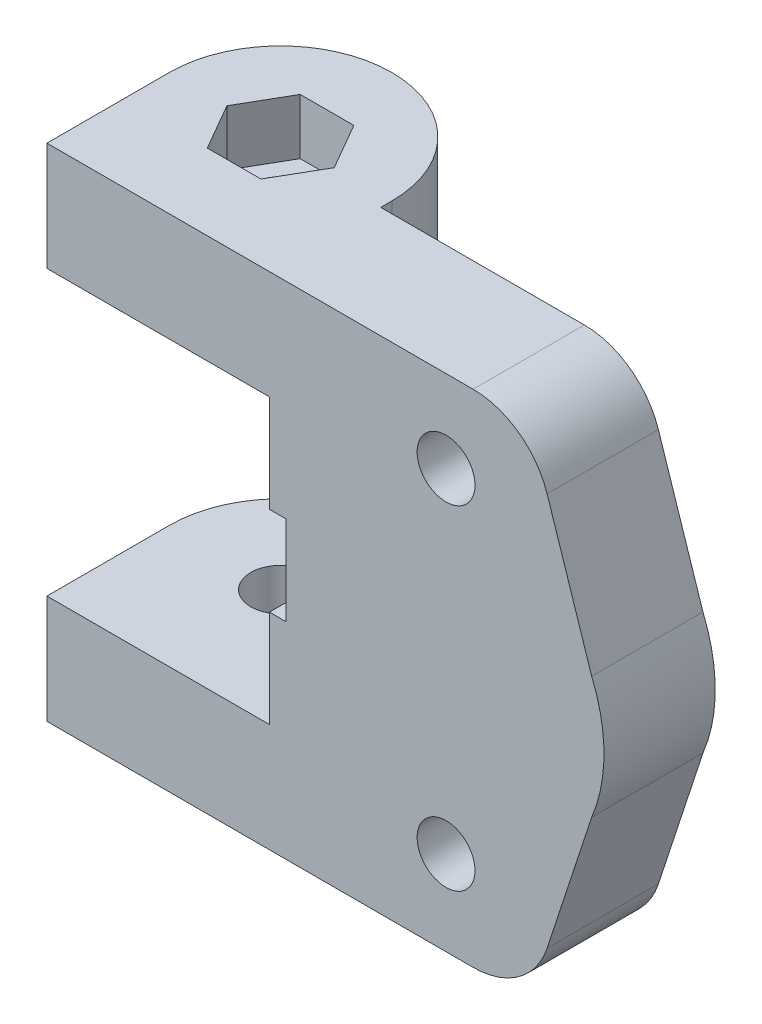
from build123d import *

# Parameters (mm, degrees)
SKETCH1_R           = 9.5
BOSS_EXTRUDE1_DEPTH = 10
BOSS_EXTRUDE4_START = -9.75
BOSS_EXTRUDE4_DEPTH = 9.75
BOSS_EXTRUDE5_DEPTH = 9.75
SKETCH19_R          = 2.675
CUT_EXTRUDE1_DEPTH  = 54.237071403
CUT_EXTRUDE2_DEPTH  = 1
SKETCH21_R          = 9.541498329
BOSS_EXTRUDE6_DEPTH = 8
SKETCH22_W          = 10.184582577
SKETCH22_H          = 8
CUT_EXTRUDE3_DEPTH  = 1
SKETCH24_R          = 2.6
BOSS_EXTRUDE8_DEPTH = 1
SKETCH25_R          = 2.6
BOSS_EXTRUDE9_DEPTH = 5
SKETCH26_R          = 4.5
CUT_EXTRUDE4_DEPTH  = 5
CUT_EXTRUDE5_DEPTH  = 5
FILLET1_R           = 3
FILLET2_R           = 10


with BuildPart() as part:
    # Sketch1 → Boss-Extrude1 (new body)
    with BuildSketch(Plane.XY):
        with BuildLine():
            Line((-23.433441641, -14.957015859), (-23.433441641, -24.707015859))
            Line((-23.433441641, -24.707015859), (14.870192677, -24.707015859))
            ThreePointArc((14.870192677, -24.707015859), (18.975681404, -23.376668609), (21.520677092, -19.891290805))
            Line((21.520677092, -19.891290805), (25.525569024, -7.69755511))
            ThreePointArc((25.525569024, -7.69755511), (26.630542081, -2.207015859), (25.525569024, 3.283523393))
            Line((25.525569024, 3.283523393), (21.520677092, 15.477259087))
            ThreePointArc((21.520677092, 15.477259087), (18.975681404, 18.962636892), (14.870192677, 20.292984141))
            Line((14.870192677, 20.292984141), (-23.433441641, 20.292984141))
            Line((-23.433441641, 20.292984141), (-23.433441641, 10.542984141))
            Line((-23.433441641, 10.542984141), (-3.433441641, 10.542984141))
            Line((-3.433441641, 10.542984141), (-3.433441641, 1.794523598))
            Line((-3.433441641, 1.794523598), (-1.933441641, 1.794523598))
            Line((-1.933441641, 1.794523598), (-1.933441641, -6.205476402))
            Line((-1.933441641, -6.205476402), (-3.433441641, -6.205476402))
            Line((-3.433441641, -6.205476402), (-3.433441641, -14.957015859))
            Line((-3.433441641, -14.957015859), (-23.433441641, -14.957015859))
        make_face()
        with Locations((12.436989349, -2.207015859)):
            Circle(SKETCH1_R, mode=Mode.SUBTRACT)
        Polygon((10.026551975, -12.925000001), (14.847426723, -12.925000001), (17.257864097, -17.100000001), (14.847426723, -21.275000001), (10.026551975, -21.275000001), (7.616114601, -17.100000001), align=None, mode=Mode.SUBTRACT)
        Polygon((14.847426723, 8.724999999), (17.257864097, 12.899999999), (14.847426723, 17.074999999), (10.026551975, 17.074999999), (7.616114601, 12.899999999), (10.026551975, 8.724999999), align=None, mode=Mode.SUBTRACT)
    extrude(amount=BOSS_EXTRUDE1_DEPTH)

    # Sketch2 → Boss-Extrude4 (add)
    with BuildSketch(Plane(origin=(0, 20.292984141, 0), x_dir=(1, 0, 0), z_dir=(0, 1, 0)).offset(BOSS_EXTRUDE4_START)):
        with BuildLine():
            Line((-23.433441641, 0), (-3.433441641, 0))
            ThreePointArc((-3.433441641, 0), (-6.362373829, 7.071067812), (-13.433441641, 10))
            Line((-13.433441641, 10), (-23.433441641, 10))
            Line((-23.433441641, 10), (-23.433441641, 0))
        make_face()
    extrude(amount=BOSS_EXTRUDE4_DEPTH)

    # Sketch18 → Boss-Extrude5 (add)
    with BuildSketch(Plane.XZ.offset(24.707015859)):
        with BuildLine():
            Line((-23.433441641, 0), (-3.433441641, 0))
            ThreePointArc((-3.433441641, 0), (-6.362373829, -7.071067812), (-13.433441641, -10))
            Line((-13.433441641, -10), (-23.433441641, -10))
            Line((-23.433441641, -10), (-23.433441641, 0))
        make_face()
    extrude(amount=-BOSS_EXTRUDE5_DEPTH)

    # Sketch19 → Cut-Extrude1 (cut, through all)
    with BuildSketch(Plane.XZ.offset(24.707015859)):
        with Locations(Location((-13.433441641, 0, 0), (0, 0, 270))):
            Circle(SKETCH19_R)
    extrude(amount=-CUT_EXTRUDE1_DEPTH, mode=Mode.SUBTRACT)

    # Sketch20 → Cut-Extrude2 (cut)
    with BuildSketch(Plane(origin=(0, 0, 0), x_dir=(-1, 0, 0), z_dir=(0, 0, -1))):
        Polygon((3.433441641, -24.707015859), (3.433441641, 20.292984141), (-35.58098809, 20.292984141), (-33.558086905, -24.707015859), align=None)
    extrude(amount=-CUT_EXTRUDE2_DEPTH, mode=Mode.SUBTRACT)

    # Sketch21 → Boss-Extrude6 (add)
    with BuildSketch(Plane.XY.offset(10)):
        with Locations((12.436989349, -2.207015859)):
            Circle(SKETCH21_R)
    extrude(amount=-BOSS_EXTRUDE6_DEPTH)

    # Sketch22 → Cut-Extrude3 (cut)
    with BuildSketch(Plane(origin=(0, 0, 1), x_dir=(-1, 0, 0), z_dir=(0, 0, -1))):
        with Locations((-3.158849648, -2.205476402)):
            Rectangle(SKETCH22_W, SKETCH22_H)
    extrude(amount=-CUT_EXTRUDE3_DEPTH, mode=Mode.SUBTRACT)

    # Sketch24 → Boss-Extrude8 (add)
    # profile 1 of 3: a face of its own
    with BuildSketch(Plane.XY.offset(10)):
        with BuildLine():
            Line((14.870192677, -24.707015859), (-23.433441641, -24.707015859))
            Line((-23.433441641, -24.707015859), (-23.433441641, -14.957015859))
            Line((-23.433441641, -14.957015859), (-3.433441641, -14.957015859))
            Line((-3.433441641, -14.957015859), (-3.433441641, -6.205476402))
            Line((-3.433441641, -6.205476402), (-1.933441641, -6.205476402))
            Line((-1.933441641, -6.205476402), (-1.933441641, 1.794523598))
            Line((-1.933441641, 1.794523598), (-3.433441641, 1.794523598))
            Line((-3.433441641, 1.794523598), (-3.433441641, 10.542984141))
            Line((-3.433441641, 10.542984141), (-23.433441641, 10.542984141))
            Line((-23.433441641, 10.542984141), (-23.433441641, 20.292984141))
            Line((-23.433441641, 20.292984141), (14.870192677, 20.292984141))
            ThreePointArc((14.870192677, 20.292984141), (18.975681404, 18.962636892), (21.520677092, 15.477259087))
            Line((21.520677092, 15.477259087), (25.525569024, 3.283523393))
            ThreePointArc((25.525569024, 3.283523393), (26.630542081, -2.207015859), (25.525569024, -7.69755511))
            Line((25.525569024, -7.69755511), (21.520677092, -19.891290805))
            ThreePointArc((21.520677092, -19.891290805), (18.975681404, -23.376668609), (14.870192677, -24.707015859))
        make_face()
        Polygon((14.847426723, 8.724999999), (17.257864097, 12.899999999), (14.847426723, 17.074999999), (10.026551975, 17.074999999), (7.616114601, 12.899999999), (10.026551975, 8.724999999), align=None, mode=Mode.SUBTRACT)
        Polygon((10.026551975, -12.925000001), (14.847426723, -12.925000001), (17.257864097, -17.100000001), (14.847426723, -21.275000001), (10.026551975, -21.275000001), (7.616114601, -17.100000001), align=None, mode=Mode.SUBTRACT)
    # profile 2 of 3: a face of its own
    with BuildSketch(Plane.XY.offset(10)):
        with Locations((12.436989349, 12.899999999)):
            Circle(SKETCH24_R)
    # profile 3 of 3: a face of its own
    with BuildSketch(Plane.XY.offset(10)):
        with Locations((12.436989349, -17.100000001)):
            Circle(SKETCH24_R)
    extrude(amount=BOSS_EXTRUDE8_DEPTH)


with BuildPart() as boss_extrude8_kept_piece:
    # of the separate pieces the step leaves, the one the design keeps (boss_extrude8_pieces_kept)
    add(part.part.solids().sort_by_distance((-3.433441641, -14.957015859, 0))[0])

    # Sketch25 → Boss-Extrude9 (add)
    # profile 1 of 2: a face of its own
    with BuildSketch(Plane.XY.offset(11)):
        Polygon((10.026551975, 8.724999999), (14.847426723, 8.724999999), (17.257864097, 12.899999999), (14.847426723, 17.074999999), (10.026551975, 17.074999999), (7.616114601, 12.899999999), align=None)
        with Locations((12.436989349, 12.899999999)):
            Circle(SKETCH25_R, mode=Mode.SUBTRACT)
    # profile 2 of 2: a face of its own
    with BuildSketch(Plane.XY.offset(11)):
        Polygon((14.847426723, -12.925000001), (10.026551975, -12.925000001), (7.616114601, -17.100000001), (10.026551975, -21.275000001), (14.847426723, -21.275000001), (17.257864097, -17.100000001), align=None)
        with Locations((12.436989349, -17.100000001)):
            Circle(SKETCH25_R, mode=Mode.SUBTRACT)
    extrude(amount=-BOSS_EXTRUDE9_DEPTH)

    # Sketch26 → Cut-Extrude4 (cut)
    with BuildSketch(Plane.XZ.offset(24.707015859)):
        with Locations((-13.433441641, 0)):
            Circle(SKETCH26_R)
    extrude(amount=-CUT_EXTRUDE4_DEPTH, mode=Mode.SUBTRACT)

    # Sketch27 → Cut-Extrude5 (cut)
    with BuildSketch(Plane(origin=(0, 20.292984141, 0), x_dir=(1, 0, 0), z_dir=(0, 1, 0))):
        Polygon((-8.612566893, 0), (-11.023004267, 4.175), (-15.843879015, 4.175), (-18.254316389, 0), (-15.843879015, -4.175), (-11.023004267, -4.175), align=None)
    extrude(amount=-CUT_EXTRUDE5_DEPTH, mode=Mode.SUBTRACT)

    # Fillet1
    fillet1_edges = [boss_extrude8_kept_piece.edges().sort_by_distance(p)[0] for p in [
        (-1.933441641, -2.205476402, 2),
    ]]
    fillet(fillet1_edges, radius=FILLET1_R)

    # Fillet2
    fillet2_edges = [boss_extrude8_kept_piece.edges().sort_by_distance(p)[0] for p in [
        (-23.433441641, -19.832015859, -10),
        (-23.433441641, 15.417984141, -10),
    ]]
    fillet(fillet2_edges, radius=FILLET2_R - 0.0001)  # a hair under: the kernel refuses the full size


solid = boss_extrude8_kept_piece.part
